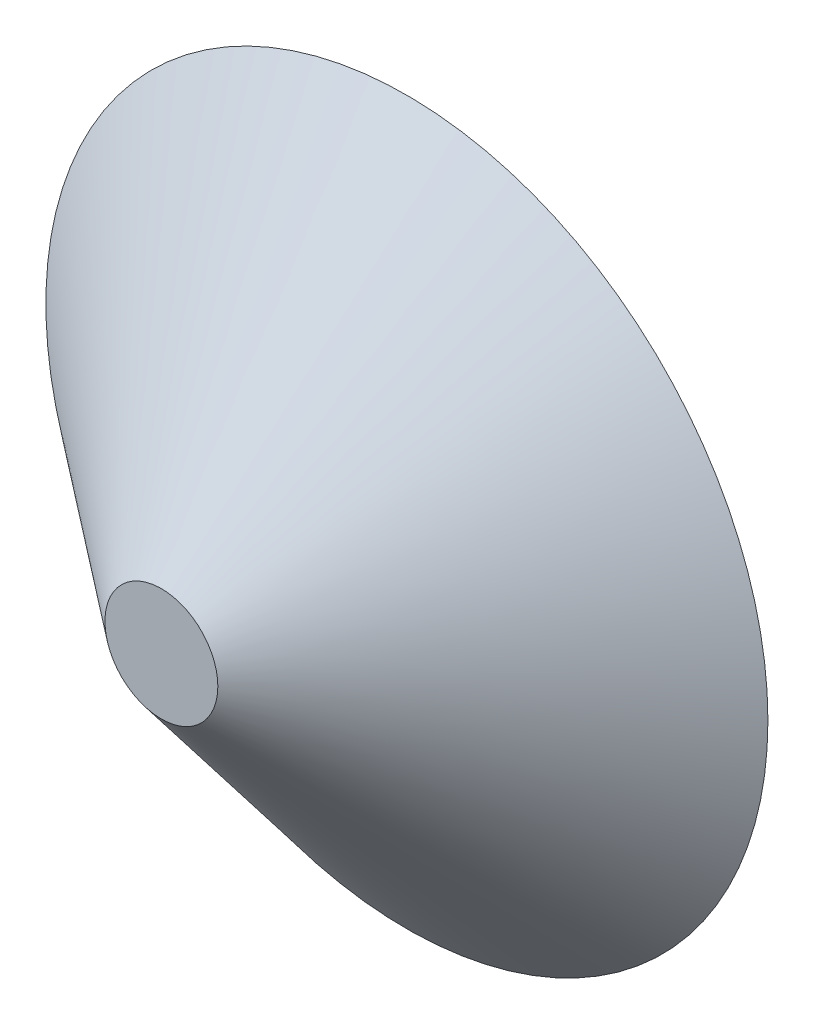
from build123d import *

# Parameters (mm, degrees)
SKETCH1_R           = 140
BOSS_EXTRUDE4_DEPTH = 95.2
BOSS_EXTRUDE4_TAPER = 51.13


# Read off the part's stored shape, not the designer's step: Shell5
with BuildPart() as part:
    # Sketch1 → Boss-Extrude4 (new body)
    with BuildSketch(Plane.XY):
        Circle(SKETCH1_R)
    extrude(amount=BOSS_EXTRUDE4_DEPTH, taper=BOSS_EXTRUDE4_TAPER)

    # Shell5 outline → Shell5 (revolve, cut)
    with BuildSketch(Plane.XZ):
        Polygon((129.992916713, 0), (18.08698658, 90.2), (0, 90.2), (0, 0), align=None)
    revolve(axis=Axis((0, 0, 0), (0, 0, 1)), mode=Mode.SUBTRACT)


solid = part.part
